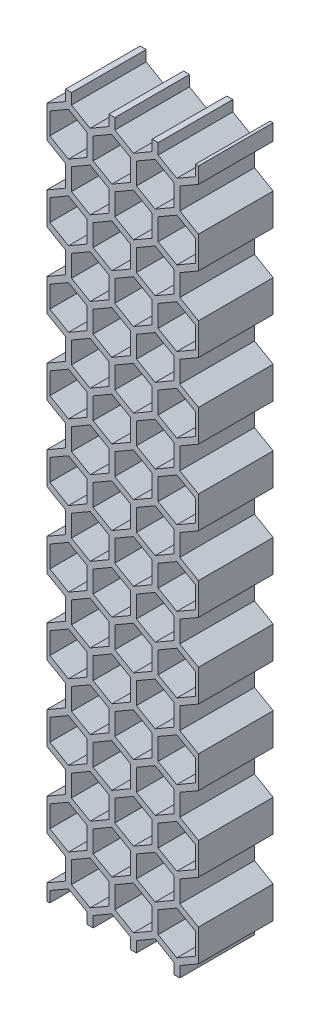
from build123d import *

# Parameters (mm, degrees)
BOSS_EXTRUDE1_DEPTH = 10


with BuildPart() as part:
    # Sketch1 → Boss-Extrude1 (new body)
    with BuildSketch(Plane.XY):
        Polygon((2.5, 1.443375673), (2.5, -1.443375673), (0, -2.886751346), (0, -5.022947342), (0.4, -5.022947342), (0.4, -3.579571669), (2.9, -2.136195996), (5.4, -3.579571669), (5.4, -5.022947342), (6.2, -5.022947342), (6.2, -3.579571669), (8.7, -2.136195996), (11.2, -3.579571669), (11.2, -5.022947342), (12, -5.022947342), (12, -3.579571669), (14.5, -2.136195996), (17, -3.579571669), (17, -5.022947342), (17.8, -5.022947342), (17.8, -3.579571669), (20.3, -2.136195996), (20.3, 2.130301312), (17.8, 3.573676985), (17.8, 6.460428331), (20.3, 7.903804004), (20.3, 12.170301312), (17.8, 13.613676985), (17.8, 16.500428331), (20.3, 17.943804004), (20.3, 22.210301312), (17.8, 23.653676985), (17.8, 26.540428331), (20.3, 27.983804004), (20.3, 32.250301312), (17.8, 33.693676985), (17.8, 36.580428331), (20.3, 38.023804004), (20.3, 42.290301312), (17.8, 43.733676985), (17.8, 46.620428331), (20.3, 48.063804004), (20.3, 52.330301312), (17.8, 53.773676985), (17.8, 56.660428331), (20.3, 58.103804004), (20.3, 62.370301312), (17.8, 63.813676985), (17.8, 66.700428331), (20.3, 68.143804004), (20.3, 72.410301312), (17.8, 73.853676985), (17.8, 76.740428331), (20.3, 78.183804004), (20.3, 82.450301312), (17.8, 83.893676985), (17.8, 86.780428331), (20.3, 88.223804004), (20.3, 90.36), (19.9, 90.36), (19.9, 88.916624327), (17.4, 87.473248654), (14.9, 88.916624327), (14.9, 90.36), (14.1, 90.36), (14.1, 88.916624327), (11.6, 87.473248654), (9.1, 88.916624327), (9.1, 90.36), (8.3, 90.36), (8.3, 88.916624327), (5.8, 87.473248654), (3.3, 88.916624327), (3.3, 90.36), (2.5, 90.36), (2.5, 88.916624327), (0, 87.473248654), (0, 83.206751346), (2.5, 81.763375673), (2.5, 78.876624327), (0, 77.433248654), (0, 73.166751346), (2.5, 71.723375673), (2.5, 68.836624327), (0, 67.393248654), (0, 63.126751346), (2.5, 61.683375673), (2.5, 58.796624327), (0, 57.353248654), (0, 53.086751346), (2.5, 51.643375673), (2.5, 48.756624327), (0, 47.313248654), (0, 43.046751346), (2.5, 41.603375673), (2.5, 38.716624327), (0, 37.273248654), (0, 33.006751346), (2.5, 31.563375673), (2.5, 28.676624327), (0, 27.233248654), (0, 22.966751346), (2.5, 21.523375673), (2.5, 18.636624327), (0, 17.193248654), (0, 12.926751346), (2.5, 11.483375673), (2.5, 8.596624327), (0, 7.153248654), (0, 2.886751346), align=None)
        Polygon((5.4, 6.460428331), (5.4, 3.573676985), (2.9, 2.130301312), (0.4, 3.573676985), (0.4, 6.460428331), (2.9, 7.903804004), align=None, mode=Mode.SUBTRACT)
        Polygon((5.4, 16.500428331), (5.4, 13.613676985), (2.9, 12.170301312), (0.4, 13.613676985), (0.4, 16.500428331), (2.9, 17.943804004), align=None, mode=Mode.SUBTRACT)
        Polygon((8.3, 1.443375673), (8.3, -1.443375673), (5.8, -2.886751346), (3.3, -1.443375673), (3.3, 1.443375673), (5.8, 2.886751346), align=None, mode=Mode.SUBTRACT)
        Polygon((8.3, 11.483375673), (8.3, 8.596624327), (5.8, 7.153248654), (3.3, 8.596624327), (3.3, 11.483375673), (5.8, 12.926751346), align=None, mode=Mode.SUBTRACT)
        Polygon((11.2, 6.460428331), (11.2, 3.573676985), (8.7, 2.130301312), (6.2, 3.573676985), (6.2, 6.460428331), (8.7, 7.903804004), align=None, mode=Mode.SUBTRACT)
        Polygon((11.2, 16.500428331), (11.2, 13.613676985), (8.7, 12.170301312), (6.2, 13.613676985), (6.2, 16.500428331), (8.7, 17.943804004), align=None, mode=Mode.SUBTRACT)
        Polygon((5.4, 26.540428331), (5.4, 23.653676985), (2.9, 22.210301312), (0.4, 23.653676985), (0.4, 26.540428331), (2.9, 27.983804004), align=None, mode=Mode.SUBTRACT)
        Polygon((5.4, 36.580428331), (5.4, 33.693676985), (2.9, 32.250301312), (0.4, 33.693676985), (0.4, 36.580428331), (2.9, 38.023804004), align=None, mode=Mode.SUBTRACT)
        Polygon((8.3, 21.523375673), (8.3, 18.636624327), (5.8, 17.193248654), (3.3, 18.636624327), (3.3, 21.523375673), (5.8, 22.966751346), align=None, mode=Mode.SUBTRACT)
        Polygon((11.2, 26.540428331), (11.2, 23.653676985), (8.7, 22.210301312), (6.2, 23.653676985), (6.2, 26.540428331), (8.7, 27.983804004), align=None, mode=Mode.SUBTRACT)
        Polygon((8.3, 31.563375673), (8.3, 28.676624327), (5.8, 27.233248654), (3.3, 28.676624327), (3.3, 31.563375673), (5.8, 33.006751346), align=None, mode=Mode.SUBTRACT)
        Polygon((8.3, 41.603375673), (8.3, 38.716624327), (5.8, 37.273248654), (3.3, 38.716624327), (3.3, 41.603375673), (5.8, 43.046751346), align=None, mode=Mode.SUBTRACT)
        Polygon((11.2, 36.580428331), (11.2, 33.693676985), (8.7, 32.250301312), (6.2, 33.693676985), (6.2, 36.580428331), (8.7, 38.023804004), align=None, mode=Mode.SUBTRACT)
        Polygon((14.1, 1.443375673), (14.1, -1.443375673), (11.6, -2.886751346), (9.1, -1.443375673), (9.1, 1.443375673), (11.6, 2.886751346), align=None, mode=Mode.SUBTRACT)
        Polygon((14.1, 11.483375673), (14.1, 8.596624327), (11.6, 7.153248654), (9.1, 8.596624327), (9.1, 11.483375673), (11.6, 12.926751346), align=None, mode=Mode.SUBTRACT)
        Polygon((17, 6.460428331), (17, 3.573676985), (14.5, 2.130301312), (12, 3.573676985), (12, 6.460428331), (14.5, 7.903804004), align=None, mode=Mode.SUBTRACT)
        Polygon((17, 16.500428331), (17, 13.613676985), (14.5, 12.170301312), (12, 13.613676985), (12, 16.500428331), (14.5, 17.943804004), align=None, mode=Mode.SUBTRACT)
        Polygon((19.9, 1.443375673), (19.9, -1.443375673), (17.4, -2.886751346), (14.9, -1.443375673), (14.9, 1.443375673), (17.4, 2.886751346), align=None, mode=Mode.SUBTRACT)
        Polygon((19.9, 11.483375673), (19.9, 8.596624327), (17.4, 7.153248654), (14.9, 8.596624327), (14.9, 11.483375673), (17.4, 12.926751346), align=None, mode=Mode.SUBTRACT)
        Polygon((14.1, 21.523375673), (14.1, 18.636624327), (11.6, 17.193248654), (9.1, 18.636624327), (9.1, 21.523375673), (11.6, 22.966751346), align=None, mode=Mode.SUBTRACT)
        Polygon((17, 26.540428331), (17, 23.653676985), (14.5, 22.210301312), (12, 23.653676985), (12, 26.540428331), (14.5, 27.983804004), align=None, mode=Mode.SUBTRACT)
        Polygon((14.1, 31.563375673), (14.1, 28.676624327), (11.6, 27.233248654), (9.1, 28.676624327), (9.1, 31.563375673), (11.6, 33.006751346), align=None, mode=Mode.SUBTRACT)
        Polygon((14.1, 41.603375673), (14.1, 38.716624327), (11.6, 37.273248654), (9.1, 38.716624327), (9.1, 41.603375673), (11.6, 43.046751346), align=None, mode=Mode.SUBTRACT)
        Polygon((17, 36.580428331), (17, 33.693676985), (14.5, 32.250301312), (12, 33.693676985), (12, 36.580428331), (14.5, 38.023804004), align=None, mode=Mode.SUBTRACT)
        Polygon((19.9, 21.523375673), (19.9, 18.636624327), (17.4, 17.193248654), (14.9, 18.636624327), (14.9, 21.523375673), (17.4, 22.966751346), align=None, mode=Mode.SUBTRACT)
        Polygon((19.9, 31.563375673), (19.9, 28.676624327), (17.4, 27.233248654), (14.9, 28.676624327), (14.9, 31.563375673), (17.4, 33.006751346), align=None, mode=Mode.SUBTRACT)
        Polygon((19.9, 41.603375673), (19.9, 38.716624327), (17.4, 37.273248654), (14.9, 38.716624327), (14.9, 41.603375673), (17.4, 43.046751346), align=None, mode=Mode.SUBTRACT)
        Polygon((5.4, 46.620428331), (5.4, 43.733676985), (2.9, 42.290301312), (0.4, 43.733676985), (0.4, 46.620428331), (2.9, 48.063804004), align=None, mode=Mode.SUBTRACT)
        Polygon((5.4, 56.660428331), (5.4, 53.773676985), (2.9, 52.330301312), (0.4, 53.773676985), (0.4, 56.660428331), (2.9, 58.103804004), align=None, mode=Mode.SUBTRACT)
        Polygon((5.4, 66.700428331), (5.4, 63.813676985), (2.9, 62.370301312), (0.4, 63.813676985), (0.4, 66.700428331), (2.9, 68.143804004), align=None, mode=Mode.SUBTRACT)
        Polygon((8.3, 51.643375673), (8.3, 48.756624327), (5.8, 47.313248654), (3.3, 48.756624327), (3.3, 51.643375673), (5.8, 53.086751346), align=None, mode=Mode.SUBTRACT)
        Polygon((11.2, 46.620428331), (11.2, 43.733676985), (8.7, 42.290301312), (6.2, 43.733676985), (6.2, 46.620428331), (8.7, 48.063804004), align=None, mode=Mode.SUBTRACT)
        Polygon((11.2, 56.660428331), (11.2, 53.773676985), (8.7, 52.330301312), (6.2, 53.773676985), (6.2, 56.660428331), (8.7, 58.103804004), align=None, mode=Mode.SUBTRACT)
        Polygon((8.3, 61.683375673), (8.3, 58.796624327), (5.8, 57.353248654), (3.3, 58.796624327), (3.3, 61.683375673), (5.8, 63.126751346), align=None, mode=Mode.SUBTRACT)
        Polygon((11.2, 66.700428331), (11.2, 63.813676985), (8.7, 62.370301312), (6.2, 63.813676985), (6.2, 66.700428331), (8.7, 68.143804004), align=None, mode=Mode.SUBTRACT)
        Polygon((5.4, 76.740428331), (5.4, 73.853676985), (2.9, 72.410301312), (0.4, 73.853676985), (0.4, 76.740428331), (2.9, 78.183804004), align=None, mode=Mode.SUBTRACT)
        Polygon((5.4, 86.780428331), (5.4, 83.893676985), (2.9, 82.450301312), (0.4, 83.893676985), (0.4, 86.780428331), (2.9, 88.223804004), align=None, mode=Mode.SUBTRACT)
        Polygon((8.3, 71.723375673), (8.3, 68.836624327), (5.8, 67.393248654), (3.3, 68.836624327), (3.3, 71.723375673), (5.8, 73.166751346), align=None, mode=Mode.SUBTRACT)
        Polygon((8.3, 81.763375673), (8.3, 78.876624327), (5.8, 77.433248654), (3.3, 78.876624327), (3.3, 81.763375673), (5.8, 83.206751346), align=None, mode=Mode.SUBTRACT)
        Polygon((11.2, 76.740428331), (11.2, 73.853676985), (8.7, 72.410301312), (6.2, 73.853676985), (6.2, 76.740428331), (8.7, 78.183804004), align=None, mode=Mode.SUBTRACT)
        Polygon((11.2, 86.780428331), (11.2, 83.893676985), (8.7, 82.450301312), (6.2, 83.893676985), (6.2, 86.780428331), (8.7, 88.223804004), align=None, mode=Mode.SUBTRACT)
        Polygon((14.1, 51.643375673), (14.1, 48.756624327), (11.6, 47.313248654), (9.1, 48.756624327), (9.1, 51.643375673), (11.6, 53.086751346), align=None, mode=Mode.SUBTRACT)
        Polygon((17, 46.620428331), (17, 43.733676985), (14.5, 42.290301312), (12, 43.733676985), (12, 46.620428331), (14.5, 48.063804004), align=None, mode=Mode.SUBTRACT)
        Polygon((17, 56.660428331), (17, 53.773676985), (14.5, 52.330301312), (12, 53.773676985), (12, 56.660428331), (14.5, 58.103804004), align=None, mode=Mode.SUBTRACT)
        Polygon((14.1, 61.683375673), (14.1, 58.796624327), (11.6, 57.353248654), (9.1, 58.796624327), (9.1, 61.683375673), (11.6, 63.126751346), align=None, mode=Mode.SUBTRACT)
        Polygon((17, 66.700428331), (17, 63.813676985), (14.5, 62.370301312), (12, 63.813676985), (12, 66.700428331), (14.5, 68.143804004), align=None, mode=Mode.SUBTRACT)
        Polygon((19.9, 51.643375673), (19.9, 48.756624327), (17.4, 47.313248654), (14.9, 48.756624327), (14.9, 51.643375673), (17.4, 53.086751346), align=None, mode=Mode.SUBTRACT)
        Polygon((19.9, 61.683375673), (19.9, 58.796624327), (17.4, 57.353248654), (14.9, 58.796624327), (14.9, 61.683375673), (17.4, 63.126751346), align=None, mode=Mode.SUBTRACT)
        Polygon((14.1, 71.723375673), (14.1, 68.836624327), (11.6, 67.393248654), (9.1, 68.836624327), (9.1, 71.723375673), (11.6, 73.166751346), align=None, mode=Mode.SUBTRACT)
        Polygon((14.1, 81.763375673), (14.1, 78.876624327), (11.6, 77.433248654), (9.1, 78.876624327), (9.1, 81.763375673), (11.6, 83.206751346), align=None, mode=Mode.SUBTRACT)
        Polygon((17, 76.740428331), (17, 73.853676985), (14.5, 72.410301312), (12, 73.853676985), (12, 76.740428331), (14.5, 78.183804004), align=None, mode=Mode.SUBTRACT)
        Polygon((17, 86.780428331), (17, 83.893676985), (14.5, 82.450301312), (12, 83.893676985), (12, 86.780428331), (14.5, 88.223804004), align=None, mode=Mode.SUBTRACT)
        Polygon((19.9, 71.723375673), (19.9, 68.836624327), (17.4, 67.393248654), (14.9, 68.836624327), (14.9, 71.723375673), (17.4, 73.166751346), align=None, mode=Mode.SUBTRACT)
        Polygon((19.9, 81.763375673), (19.9, 78.876624327), (17.4, 77.433248654), (14.9, 78.876624327), (14.9, 81.763375673), (17.4, 83.206751346), align=None, mode=Mode.SUBTRACT)
    extrude(amount=BOSS_EXTRUDE1_DEPTH)


solid = part.part
